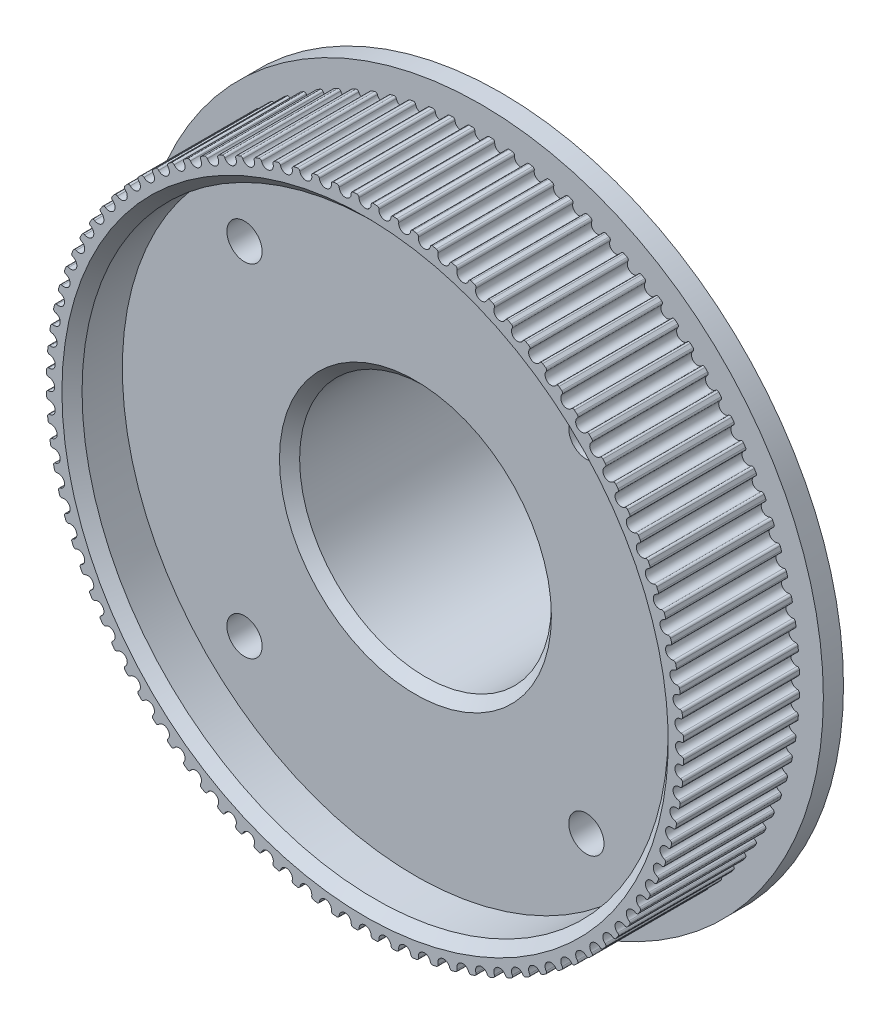
from build123d import *

# Parameters (mm, degrees)
SKETCHREVOLVEGEARBELT01_W       = 11.5
SKETCHREVOLVEGEARBELT01_H       = 31.640488143
TOOTHEXTRUDECUTGEARBELT01_DEPTH = 11.5
PATTERNGEARBELT01_COUNT         = 100
SKETCH_5_R                      = 34
EXTRUDE_1_DEPTH                 = 2
SKETCH_6_R                      = 29.1
CUT_EXTRUDE_2_DEPTH             = 5
SKETCH_7_R                      = 20
EXTRUDE_2_DEPTH                 = 2
SKETCH_8_R                      = 17.5
EXTRUDE_3_DEPTH                 = 10
SKETCH_9_R                      = 1.75
CUT_EXTRUDE_3_DEPTH             = 55.426556018
PATTERN_CIRCULAR_2_COUNT        = 4
CUT_EXTRUDE_START               = -8.5
SKETCH_9_3_R                    = 3.25
CUT_EXTRUDE_4_DEPTH             = 46.926556018
PATTERN_CIRCULAR_3_COUNT        = 4
SKETCH_11_R                     = 12.5
CUT_EXTRUDE_5_DEPTH             = 55.426556018
CHAMFER1_SIZE                   = 1
CHAMFER2_SIZE                   = 1


with BuildPart() as part:
    # SketchRevolveGearBelt01 → GearBelt01 (revolve)
    with BuildSketch(Plane(origin=(0, 0, 0), x_dir=(0, 0, -1), z_dir=(1, 0, 0))):
        with Locations((5.75, 15.820244072)):
            Rectangle(SKETCHREVOLVEGEARBELT01_W, SKETCHREVOLVEGEARBELT01_H)
    revolve(axis=Axis((0, 0, 0), (0, 0, -1)))

    # SketchToothGearBelt01 → ToothExtrudeCutGearBelt01 (cut)
    with BuildSketch(Plane.XY):
        with BuildLine():
            Line((-0.813963777, 31.630016644), (0, 34.180488105))
            Line((0, 34.180488105), (0.813963777, 31.630016644))
            ThreePointArc((0.813963777, 31.630016644), (0.663006412, 31.570874086), (0.599999991, 31.421488146))
            ThreePointArc((0.599999991, 31.421488146), (0, 30.821488155), (-0.599999991, 31.421488146))
            ThreePointArc((-0.599999991, 31.421488146), (-0.663006412, 31.570874086), (-0.813963777, 31.630016644))
        make_face()
    toothextrudecutgearbelt01 = extrude(amount=-TOOTHEXTRUDECUTGEARBELT01_DEPTH, mode=Mode.SUBTRACT)

    # PatternGearBelt01: ToothExtrudeCutGearBelt01 ×100 about axis
    patterngearbelt01_axis = Axis((0, 0, 55), (0, 0, -1))
    for i in range(1, PATTERNGEARBELT01_COUNT):
        add(toothextrudecutgearbelt01.rotate(patterngearbelt01_axis, i * 360 / PATTERNGEARBELT01_COUNT), mode=Mode.SUBTRACT)

    # Эскиз5 → Бобышка-Вытянуть1 (add)
    with BuildSketch(Plane(origin=(0, 0, -11.5), x_dir=(-1, 0, 0), z_dir=(0, 0, -1))):
        Circle(SKETCH_5_R)
    extrude(amount=EXTRUDE_1_DEPTH)

    # Эскиз6 → Вырез-Вытянуть2 (cut)
    with BuildSketch(Plane.XY):
        Circle(SKETCH_6_R)
    extrude(amount=-CUT_EXTRUDE_2_DEPTH, mode=Mode.SUBTRACT)

    # Эскиз7 → Бобышка-Вытянуть2 (add)
    with BuildSketch(Plane(origin=(0, 0, -13.5), x_dir=(-1, 0, 0), z_dir=(0, 0, -1))):
        Circle(SKETCH_7_R)
    extrude(amount=EXTRUDE_2_DEPTH)

    # Эскиз8 → Бобышка-Вытянуть3 (add)
    with BuildSketch(Plane(origin=(0, 0, -15.5), x_dir=(-1, 0, 0), z_dir=(0, 0, -1))):
        Circle(SKETCH_8_R)
    extrude(amount=EXTRUDE_3_DEPTH)

    # Эскиз9 → Вырез-Вытянуть3 (cut, through all)
    with BuildSketch(Plane.XY):
        with Locations((16.970562748, 16.970562748)):
            Circle(SKETCH_9_R)
    cut_extrude_3 = extrude(amount=-CUT_EXTRUDE_3_DEPTH, mode=Mode.SUBTRACT)

    # Круговой массив2: Вырез-Вытянуть3 ×4 about axis
    pattern_circular_2_axis = Axis((0, 0, -25.5), (0, 0, 1))
    for i in range(1, PATTERN_CIRCULAR_2_COUNT):
        add(cut_extrude_3.rotate(pattern_circular_2_axis, i * 360 / PATTERN_CIRCULAR_2_COUNT), mode=Mode.SUBTRACT)

    # Эскиз9<3> → Вырез-Вытянуть4 (cut, through all)
    with BuildSketch(Plane.XY.offset(CUT_EXTRUDE_START)):
        with Locations((16.970562748, 16.970562748)):
            Circle(SKETCH_9_3_R)
    cut_extrude_4 = extrude(amount=-CUT_EXTRUDE_4_DEPTH, mode=Mode.SUBTRACT)

    # Круговой массив3: Вырез-Вытянуть4 ×4 about axis
    pattern_circular_3_axis = Axis((0, 0, -25.5), (0, 0, 1))
    for i in range(1, PATTERN_CIRCULAR_3_COUNT):
        add(cut_extrude_4.rotate(pattern_circular_3_axis, i * 360 / PATTERN_CIRCULAR_3_COUNT), mode=Mode.SUBTRACT)

    # Эскиз11 → Вырез-Вытянуть5 (cut, through all)
    with BuildSketch(Plane.XY):
        Circle(SKETCH_11_R)
    extrude(amount=-CUT_EXTRUDE_5_DEPTH, mode=Mode.SUBTRACT)

    # Chamfer1
    chamfer1_edges = [part.edges().sort_by_distance(p)[0] for p in [
        (-29.1, 0, 0),
    ]]
    chamfer(chamfer1_edges, length=CHAMFER1_SIZE)

    # Chamfer2
    chamfer2_edges = [part.edges().sort_by_distance(p)[0] for p in [
        (-12.5, 0, -25.5),
        (17.5, 0, -25.5),
        (-12.5, 0, -5),
    ]]
    chamfer(chamfer2_edges, length=CHAMFER2_SIZE)


solid = part.part
